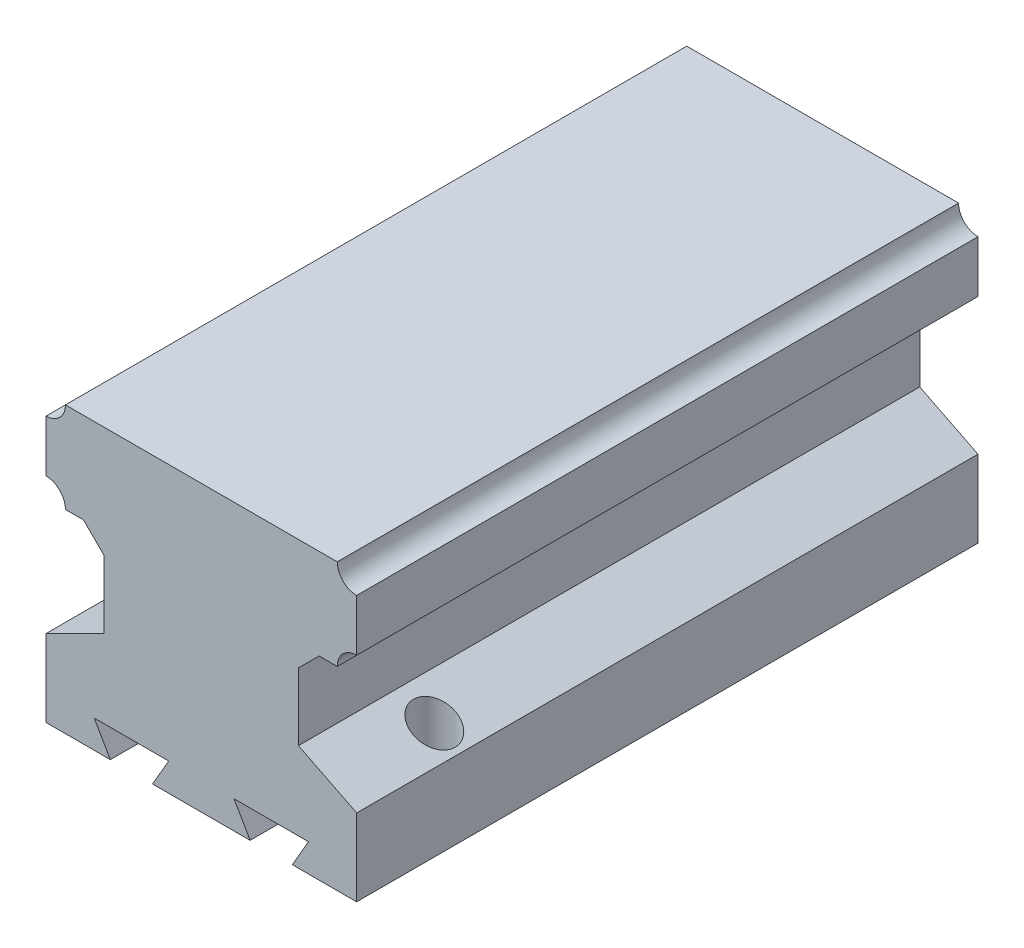
from build123d import *

# Parameters (mm, degrees)
BOSS_EXTRU_1_DEPTH        = 38.1
CONG_1_R                  = 2.38125
CHANFREIN1_SIZE           = 10.16
CHANFREIN1_SIZE_2         = 5.08
CHANFREIN2_SIZE           = 10.16
CHANFREIN2_SIZE_2         = 5.08
CHANFREIN3_SIZE           = 2.54
EMPREINTE1_START          = -38.1
EMPREINTE1_DEPTH          = 76.2
D_PLACER_START            = -38.1
D_PLACER_LA_FACE1_DEPTH   = 76.2
ESQUISSE4_W               = 1.89865
ESQUISSE4_H               = 21.2725
D_GAGEMENT_61_AT_2_COUNT  = 2
D_GAGEMENT_61_AT_2_PITCH  = 31.75
D_GAGEMENT_101_AT_2_COUNT = 2
D_GAGEMENT_101_AT_2_PITCH = 31.75


# Read off the part's stored shape, not the designer's step: Empreinte1, Déplacer la face1
# Some blends are built 0.0001 mm under size
with BuildPart() as part:
    # Esquisse2 → Boss.-Extru.1 (new, symmetric)
    with BuildSketch(Plane.XY):
        Polygon((-19.05, -15.875), (19.05, -15.875), (19.05, -7.9375), (11.90625, -7.9375), (11.90625, 7.9375), (16.66875, 7.9375), (16.66875, 10.31875), (19.05, 10.31875), (19.05, 16.66875), (16.66875, 16.66875), (16.66875, 19.05), (-16.66875, 19.05), (-16.66875, 16.66875), (-19.05, 16.66875), (-19.05, 10.31875), (-16.66875, 10.31875), (-16.66875, 7.9375), (-11.90625, 7.9375), (-11.90625, -7.9375), (-19.05, -7.9375), align=None)
    extrude(amount=BOSS_EXTRU_1_DEPTH, both=True)

    # Congé1
    cong_1_edges = [part.edges().sort_by_distance(p)[0] for p in [
        (-16.66875, 16.66875, 0),
        (-16.66875, 10.31875, 0),
        (16.66875, 10.31875, 0),
        (16.66875, 16.66875, 0),
    ]]
    fillet(cong_1_edges, radius=CONG_1_R - 0.0001)  # a hair under: the kernel refuses the full size

    # Chanfrein1
    # the kernel refuses this chamfer: 10.16, 5.08 mm, written as the material it adds along each edge
    with BuildSketch(Plane(origin=(-11.90625, -7.9375, 38.1), x_dir=(-0.9998508956747119, -0.017268075123668056, 0), z_dir=(0, 0, -1))) as chanfrein1_piece_1_section:
        Polygon((CHANFREIN1_SIZE * 0.999850895675, CHANFREIN1_SIZE * 0.0172680751237), (-CHANFREIN1_SIZE_2 * 0.0172680751237, CHANFREIN1_SIZE_2 * 0.999850895675), (0, 0), align=None)
    chanfrein1_piece_1 = extrude(amount=76.2, mode=Mode.PRIVATE)
    chanfrein1_piece_1 = split(chanfrein1_piece_1, bisect_by=Plane(origin=(-19.05, -6.161924143, 0), z_dir=(1, 0, 0)), keep=Keep.TOP, mode=Mode.PRIVATE)
    add(chanfrein1_piece_1)

    # Chanfrein2
    # the kernel refuses this chamfer: 10.16, 5.08 mm, written as the material it adds along each edge
    with BuildSketch(Plane(origin=(11.90625, -7.9375, -38.1), x_dir=(0.9998508956747119, -0.017268075123668056, 0), z_dir=(0, 0, 1))) as chanfrein2_piece_1_section:
        Polygon((CHANFREIN2_SIZE * 0.999850895675, CHANFREIN2_SIZE * 0.0172680751237), (-CHANFREIN2_SIZE_2 * 0.0172680751237, CHANFREIN2_SIZE_2 * 0.999850895675), (0, 0), align=None)
    chanfrein2_piece_1 = extrude(amount=76.2, mode=Mode.PRIVATE)
    chanfrein2_piece_1 = split(chanfrein2_piece_1, bisect_by=Plane(origin=(19.05, -6.161924143, 0), z_dir=(-1, 0, 0)), keep=Keep.TOP, mode=Mode.PRIVATE)
    add(chanfrein2_piece_1)

    # Chanfrein3
    chanfrein3_edges = [part.edges().sort_by_distance(p)[0] for p in [
        (-11.90625, 7.9375, 0),
        (11.90625, 7.9375, 0),
    ]]
    chamfer(chanfrein3_edges, length=CHANFREIN3_SIZE)

    # Empreinte1 outline → Empreinte1 (cut)
    with BuildSketch(Plane.XY.offset(EMPREINTE1_START)):
        Polygon((-6.278087105, -15.875), (-4.445, -12.7), (-12.7, -12.7), (-10.866912895, -15.875), align=None)
        Polygon((4.445, -12.7), (6.278087105, -15.875), (10.866912895, -15.875), (12.7, -12.7), align=None)
    extrude(amount=EMPREINTE1_DEPTH, mode=Mode.SUBTRACT)

    # Déplacer la face1 outline → Déplacer la face1 (cut)
    with BuildSketch(Plane.XY.offset(D_PLACER_START)):
        Polygon((-5.984793168, -15.875), (-4.005059095, -12.446), (-13.139940905, -12.446), (-11.160206832, -15.875), (-10.866912895, -15.875), (-12.7, -12.7), (-4.445, -12.7), (-6.278087105, -15.875), align=None)
        Polygon((4.005059095, -12.446), (5.984793168, -15.875), (6.278087105, -15.875), (4.445, -12.7), (12.7, -12.7), (10.866912895, -15.875), (11.160206832, -15.875), (13.139940905, -12.446), align=None)
    extrude(amount=D_PLACER_LA_FACE1_DEPTH, mode=Mode.SUBTRACT)

    # Esquisse4 → Dégagement #61 (revolve, cut)
    with BuildSketch(Plane(origin=(-15.875, 5.3975, 25.4), x_dir=(0, 0, 1), z_dir=(1, 0, 0))):
        with Locations((0.949325, 10.63625)):
            Rectangle(ESQUISSE4_W, ESQUISSE4_H)
    d_gagement_61 = revolve(axis=Axis((-15.875, 11.7475, 25.4), (0, -1, 0)), mode=Mode.SUBTRACT)

    # Dégagement #61 at 2: Dégagement #61 ×2
    with Locations(*[(i * D_GAGEMENT_61_AT_2_PITCH, 0, 0) for i in range(1, D_GAGEMENT_61_AT_2_COUNT)]):
        add(d_gagement_61, mode=Mode.SUBTRACT)

    # Esquisse7 → Dégagement #101 (revolve, cut)
    with BuildSketch(Plane(origin=(-15.875, 5.3975, 25.4), x_dir=(0, 0, 1), z_dir=(1, 0, 0))):
        Polygon((0, 0), (0, 20.329816902), (2.5527, 18.796), (2.5527, 0), align=None)
    d_gagement_101 = revolve(axis=Axis((-15.875, 11.7475, 25.4), (0, -1, 0)), mode=Mode.SUBTRACT)

    # Dégagement #101 at 2: Dégagement #101 ×2
    with Locations(*[(i * D_GAGEMENT_101_AT_2_PITCH, 0, 0) for i in range(1, D_GAGEMENT_101_AT_2_COUNT)]):
        add(d_gagement_101, mode=Mode.SUBTRACT)


solid = part.part
